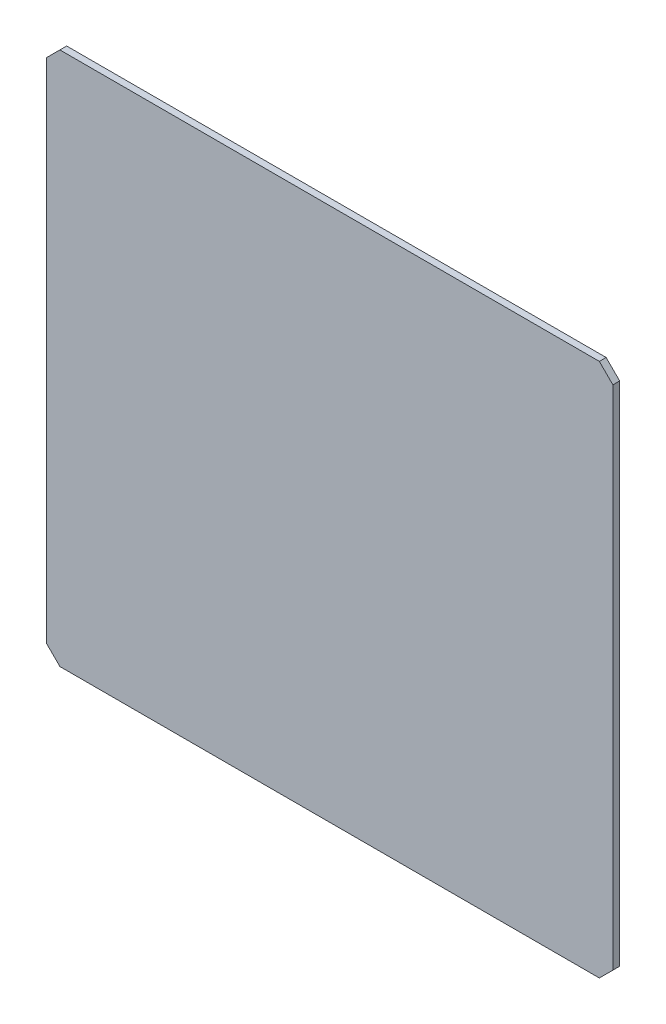
from build123d import *

# Parameters (mm, degrees)
ESTRUSIONE_ESTRUSIONE1_DEPTH = 5


with BuildPart() as part:
    # Schizzo1 → Estrusione-Estrusione1 (new body)
    with BuildSketch(Plane.XY):
        Polygon((-209, 187), (-199, 197), (199, 197), (209, 187), (209, -187), (199, -197), (-199, -197), (-209, -187), align=None)
    extrude(amount=ESTRUSIONE_ESTRUSIONE1_DEPTH)


solid = part.part
